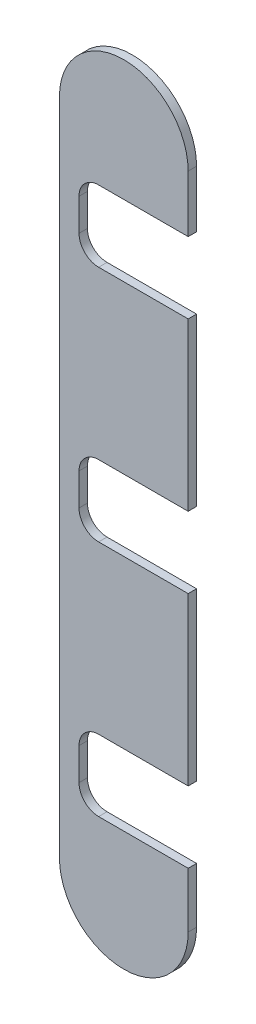
from build123d import *

# Parameters (mm, degrees)
BOSS_EXTRUDE1_DEPTH = 3
FILLET1_R           = 7


with BuildPart() as part:
    # Sketch1 → Boss-Extrude1 (new body)
    with BuildSketch(Plane.XY):
        with BuildLine():
            Line((-43, 160.25), (-43, -75.25))
            ThreePointArc((-43, -75.25), (-20, -98.25), (3, -75.25))
            Line((3, -75.25), (3, -55.5))
            Line((3, -55.5), (-36, -55.5))
            Line((-36, -55.5), (-36, -30.037570577))
            Line((-36, -30.037570577), (3, -30.037570577))
            Line((3, -30.037570577), (3, 29.5))
            Line((3, 29.5), (-36, 29.5))
            Line((-36, 29.5), (-36, 54.962429423))
            Line((-36, 54.962429423), (3, 54.962429423))
            Line((3, 54.962429423), (3, 114.5))
            Line((3, 114.5), (-36, 114.5))
            Line((-36, 114.5), (-36, 139.962429423))
            Line((-36, 139.962429423), (3, 139.962429423))
            Line((3, 139.962429423), (3, 160.25))
            ThreePointArc((3, 160.25), (-20, 183.25), (-43, 160.25))
        make_face()
    extrude(amount=BOSS_EXTRUDE1_DEPTH)

    # Fillet1
    fillet1_edges = [part.edges().sort_by_distance(p)[0] for p in [
        (-36, 139.962429423, 1.5),
        (-36, 114.5, 1.5),
        (-36, 54.962429423, 1.5),
        (-36, 29.5, 1.5),
        (-36, -55.5, 1.5),
        (-36, -30.037570577, 1.5),
    ]]
    fillet(fillet1_edges, radius=FILLET1_R)


solid = part.part
